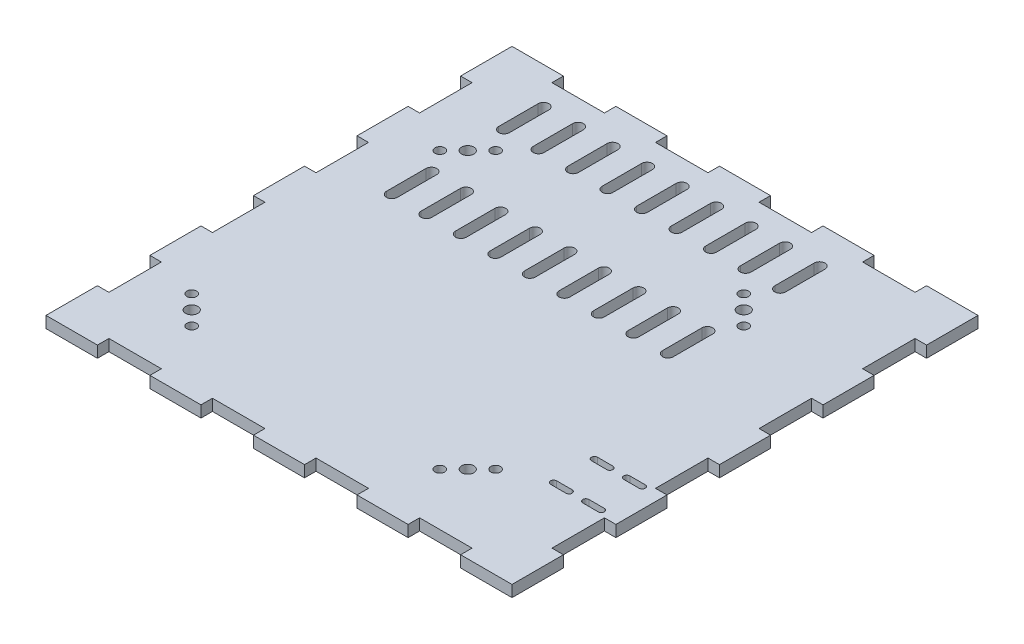
from build123d import *

# Parameters (mm, degrees)
SKETCH2_W           = 130
SKETCH2_H           = 130
SKETCH2_R           = 1.7
BOSS_EXTRUDE1_DEPTH = 3.2
CUT_EXTRUDE2_REACH  = 102.725
SKETCH5_R           = 1.35
SKETCH4_W           = 3.2
SKETCH4_H           = 14.444444445
SKETCH4_W_2         = 14.444444445
SKETCH4_H_2         = 3.2
CUT_EXTRUDE1_DEPTH  = 101.724934847
CUT_EXTRUDE3_REACH  = 102.725
CUT_EXTRUDE4_REACH  = 102.725
TOLERANCE_BY        = 0.1
TOLERANCE_2_BY      = 0.1
TOLERANCE_3_BY      = 0.1
TOLERANCE_4_BY      = 0.1
TOLERANCE_5_BY      = 0.1
TOLERANCE_6_BY      = 0.1
TOLERANCE_7_BY      = 0.1
TOLERANCE_8_BY      = 0.1
TOLERANCE_9_BY      = 0.1
TOLERANCE_10_BY     = 0.1
TOLERANCE_11_BY     = 0.1
TOLERANCE_12_BY     = 0.1
TOLERANCE_13_BY     = 0.1
TOLERANCE_14_BY     = 0.1
TOLERANCE_15_BY     = 0.1
TOLERANCE_16_BY     = 0.1
TOLERANCE_17_BY     = 0.1
TOLERANCE_18_BY     = 0.1
TOLERANCE_19_BY     = 0.1
TOLERANCE_20_BY     = 0.1
TOLERANCE_21_BY     = 0.1
TOLERANCE_22_BY     = 0.1
TOLERANCE_23_BY     = 0.1
TOLERANCE_24_BY     = 0.1
TOLERANCE_25_BY     = 0.1
TOLERANCE_26_BY     = 0.1
TOLERANCE_27_BY     = 0.1
TOLERANCE_28_BY     = 0.1
TOLERANCE_29_BY     = 0.1
TOLERANCE_30_BY     = 0.1
TOLERANCE_31_BY     = 0.1
TOLERANCE_32_BY     = 0.1


with BuildPart() as part:
    # Sketch2 → Boss-Extrude1 (new body)
    with BuildSketch(Plane(origin=(0, 0, 0), x_dir=(1, 0, 0), z_dir=(0, 1, 0))):
        with Locations((7.5, 4.85)):
            Rectangle(SKETCH2_W, SKETCH2_H)
        with Locations((-38.5, 38.5)):
            Circle(SKETCH2_R, mode=Mode.SUBTRACT)
        with Locations((-38.5, -38.5)):
            Circle(SKETCH2_R, mode=Mode.SUBTRACT)
        with Locations((38.5, -38.5)):
            Circle(SKETCH2_R, mode=Mode.SUBTRACT)
        with Locations((38.5, 38.5)):
            Circle(SKETCH2_R, mode=Mode.SUBTRACT)
    extrude(amount=BOSS_EXTRUDE1_DEPTH)

    # Sketch5 → Cut-Extrude2 (cut, up to next)
    with BuildSketch(Plane(origin=(0, 3.2, 0), x_dir=(1, 0, 0), z_dir=(0, 1, 0)), mode=Mode.PRIVATE) as cut_extrude2_sk1:
        with Locations((42.389087297, 34.610912703)):
            Circle(SKETCH5_R)
    cut_extrude2_tool1 = extrude(cut_extrude2_sk1.sketch, amount=-CUT_EXTRUDE2_REACH, mode=Mode.PRIVATE) & part.part
    # Sketch5 → Cut-Extrude2 (cut, up to next)
    with BuildSketch(Plane(origin=(0, 3.2, 0), x_dir=(1, 0, 0), z_dir=(0, 1, 0)), mode=Mode.PRIVATE) as cut_extrude2_sk2:
        with Locations((34.610912703, 42.389087297)):
            Circle(SKETCH5_R)
    cut_extrude2_tool2 = extrude(cut_extrude2_sk2.sketch, amount=-CUT_EXTRUDE2_REACH, mode=Mode.PRIVATE) & part.part
    # Sketch5 → Cut-Extrude2 (cut, up to next)
    with BuildSketch(Plane(origin=(0, 3.2, 0), x_dir=(1, 0, 0), z_dir=(0, 1, 0)), mode=Mode.PRIVATE) as cut_extrude2_sk3:
        with Locations((34.610912703, -42.389087297)):
            Circle(SKETCH5_R)
    cut_extrude2_tool3 = extrude(cut_extrude2_sk3.sketch, amount=-CUT_EXTRUDE2_REACH, mode=Mode.PRIVATE) & part.part
    # Sketch5 → Cut-Extrude2 (cut, up to next)
    with BuildSketch(Plane(origin=(0, 3.2, 0), x_dir=(1, 0, 0), z_dir=(0, 1, 0)), mode=Mode.PRIVATE) as cut_extrude2_sk4:
        with Locations((42.389087297, -34.610912703)):
            Circle(SKETCH5_R)
    cut_extrude2_tool4 = extrude(cut_extrude2_sk4.sketch, amount=-CUT_EXTRUDE2_REACH, mode=Mode.PRIVATE) & part.part
    # Sketch5 → Cut-Extrude2 (cut, up to next)
    with BuildSketch(Plane(origin=(0, 3.2, 0), x_dir=(1, 0, 0), z_dir=(0, 1, 0)), mode=Mode.PRIVATE) as cut_extrude2_sk5:
        with Locations((-42.389087297, -34.610912703)):
            Circle(SKETCH5_R)
    cut_extrude2_tool5 = extrude(cut_extrude2_sk5.sketch, amount=-CUT_EXTRUDE2_REACH, mode=Mode.PRIVATE) & part.part
    # Sketch5 → Cut-Extrude2 (cut, up to next)
    with BuildSketch(Plane(origin=(0, 3.2, 0), x_dir=(1, 0, 0), z_dir=(0, 1, 0)), mode=Mode.PRIVATE) as cut_extrude2_sk6:
        with Locations((-34.610912703, -42.389087297)):
            Circle(SKETCH5_R)
    cut_extrude2_tool6 = extrude(cut_extrude2_sk6.sketch, amount=-CUT_EXTRUDE2_REACH, mode=Mode.PRIVATE) & part.part
    # Sketch5 → Cut-Extrude2 (cut, up to next)
    with BuildSketch(Plane(origin=(0, 3.2, 0), x_dir=(1, 0, 0), z_dir=(0, 1, 0)), mode=Mode.PRIVATE) as cut_extrude2_sk7:
        with Locations((-34.610912703, 42.389087297)):
            Circle(SKETCH5_R)
    cut_extrude2_tool7 = extrude(cut_extrude2_sk7.sketch, amount=-CUT_EXTRUDE2_REACH, mode=Mode.PRIVATE) & part.part
    # Sketch5 → Cut-Extrude2 (cut, up to next)
    with BuildSketch(Plane(origin=(0, 3.2, 0), x_dir=(1, 0, 0), z_dir=(0, 1, 0)), mode=Mode.PRIVATE) as cut_extrude2_sk8:
        with Locations((-42.389087297, 34.610912703)):
            Circle(SKETCH5_R)
    cut_extrude2_tool8 = extrude(cut_extrude2_sk8.sketch, amount=-CUT_EXTRUDE2_REACH, mode=Mode.PRIVATE) & part.part
    add(cut_extrude2_tool1.solids().sort_by_distance((42.389087, 3.2, -34.610913))[0], mode=Mode.SUBTRACT)
    add(cut_extrude2_tool2.solids().sort_by_distance((34.610913, 3.2, -42.389087))[0], mode=Mode.SUBTRACT)
    add(cut_extrude2_tool3.solids().sort_by_distance((34.610913, 3.2, 42.389087))[0], mode=Mode.SUBTRACT)
    add(cut_extrude2_tool4.solids().sort_by_distance((42.389087, 3.2, 34.610913))[0], mode=Mode.SUBTRACT)
    add(cut_extrude2_tool5.solids().sort_by_distance((-42.389087, 3.2, 34.610913))[0], mode=Mode.SUBTRACT)
    add(cut_extrude2_tool6.solids().sort_by_distance((-34.610913, 3.2, 42.389087))[0], mode=Mode.SUBTRACT)
    add(cut_extrude2_tool7.solids().sort_by_distance((-34.610913, 3.2, -42.389087))[0], mode=Mode.SUBTRACT)
    add(cut_extrude2_tool8.solids().sort_by_distance((-42.389087, 3.2, -34.610913))[0], mode=Mode.SUBTRACT)

    # Sketch4 → Cut-Extrude1 (cut, through all)
    with BuildSketch(Plane(origin=(0, 3.2, 0), x_dir=(1, 0, 0), z_dir=(0, 1, 0))):
        with Locations((70.9, 48.183333334)):
            Rectangle(SKETCH4_W, SKETCH4_H)
        with Locations((70.9, 19.294444445)):
            Rectangle(SKETCH4_W, SKETCH4_H)
        with Locations((70.9, -9.594444445)):
            Rectangle(SKETCH4_W, SKETCH4_H)
        with Locations((70.9, -38.483333333)):
            Rectangle(SKETCH4_W, SKETCH4_H)
        with Locations((-35.833333334, -58.55)):
            Rectangle(SKETCH4_W_2, SKETCH4_H_2)
        with Locations((-6.944444445, -58.55)):
            Rectangle(SKETCH4_W_2, SKETCH4_H_2)
        with Locations((21.944444445, -58.55)):
            Rectangle(SKETCH4_W_2, SKETCH4_H_2)
        with Locations((50.833333334, -58.55)):
            Rectangle(SKETCH4_W_2, SKETCH4_H_2)
        with Locations((-55.9, 48.183333334)):
            Rectangle(SKETCH4_W, SKETCH4_H)
        with Locations((-55.9, 19.294444445)):
            Rectangle(SKETCH4_W, SKETCH4_H)
        with Locations((-55.9, -9.594444445)):
            Rectangle(SKETCH4_W, SKETCH4_H)
        with Locations((-55.9, -38.483333333)):
            Rectangle(SKETCH4_W, SKETCH4_H)
        with Locations((50.833333334, 68.25)):
            Rectangle(SKETCH4_W_2, SKETCH4_H_2)
        with Locations((21.944444445, 68.25)):
            Rectangle(SKETCH4_W_2, SKETCH4_H_2)
        with Locations((-6.944444445, 68.25)):
            Rectangle(SKETCH4_W_2, SKETCH4_H_2)
        with Locations((-35.833333334, 68.25)):
            Rectangle(SKETCH4_W_2, SKETCH4_H_2)
    extrude(amount=-CUT_EXTRUDE1_DEPTH, mode=Mode.SUBTRACT)

    # Sketch6 → Cut-Extrude3 (cut, up to next)
    with BuildSketch(Plane(origin=(0, 3.2, 0), x_dir=(1, 0, 0), z_dir=(0, 1, 0)), mode=Mode.PRIVATE) as cut_extrude3_sk1:
        with BuildLine():
            Line((67, -30.588888889), (62.7, -30.588888889))
            ThreePointArc((62.7, -30.588888889), (61.85, -29.738888889), (62.7, -28.888888889))
            Line((62.7, -28.888888889), (67, -28.888888889))
            ThreePointArc((67, -28.888888889), (67.85, -29.738888889), (67, -30.588888889))
        make_face()
    cut_extrude3_tool1 = extrude(cut_extrude3_sk1.sketch, amount=-CUT_EXTRUDE3_REACH, mode=Mode.PRIVATE) & part.part
    # Sketch6 → Cut-Extrude3 (cut, up to next)
    with BuildSketch(Plane(origin=(0, 3.2, 0), x_dir=(1, 0, 0), z_dir=(0, 1, 0)), mode=Mode.PRIVATE) as cut_extrude3_sk2:
        with BuildLine():
            Line((58, -30.588888889), (53.7, -30.588888889))
            ThreePointArc((53.7, -30.588888889), (52.85, -29.738888889), (53.7, -28.888888889))
            Line((53.7, -28.888888889), (58, -28.888888889))
            ThreePointArc((58, -28.888888889), (58.85, -29.738888889), (58, -30.588888889))
        make_face()
    cut_extrude3_tool2 = extrude(cut_extrude3_sk2.sketch, amount=-CUT_EXTRUDE3_REACH, mode=Mode.PRIVATE) & part.part
    # Sketch6 → Cut-Extrude3 (cut, up to next)
    with BuildSketch(Plane(origin=(0, 3.2, 0), x_dir=(1, 0, 0), z_dir=(0, 1, 0)), mode=Mode.PRIVATE) as cut_extrude3_sk3:
        with BuildLine():
            Line((58, -17.488888889), (53.7, -17.488888889))
            ThreePointArc((53.7, -17.488888889), (52.85, -18.338888889), (53.7, -19.188888889))
            Line((53.7, -19.188888889), (58, -19.188888889))
            ThreePointArc((58, -19.188888889), (58.85, -18.338888889), (58, -17.488888889))
        make_face()
    cut_extrude3_tool3 = extrude(cut_extrude3_sk3.sketch, amount=-CUT_EXTRUDE3_REACH, mode=Mode.PRIVATE) & part.part
    # Sketch6 → Cut-Extrude3 (cut, up to next)
    with BuildSketch(Plane(origin=(0, 3.2, 0), x_dir=(1, 0, 0), z_dir=(0, 1, 0)), mode=Mode.PRIVATE) as cut_extrude3_sk4:
        with BuildLine():
            Line((67, -17.488888889), (62.7, -17.488888889))
            ThreePointArc((62.7, -17.488888889), (61.85, -18.338888889), (62.7, -19.188888889))
            Line((62.7, -19.188888889), (67, -19.188888889))
            ThreePointArc((67, -19.188888889), (67.85, -18.338888889), (67, -17.488888889))
        make_face()
    cut_extrude3_tool4 = extrude(cut_extrude3_sk4.sketch, amount=-CUT_EXTRUDE3_REACH, mode=Mode.PRIVATE) & part.part
    add(cut_extrude3_tool1.solids().sort_by_distance((64.85, 3.2, 29.738889))[0], mode=Mode.SUBTRACT)
    add(cut_extrude3_tool2.solids().sort_by_distance((55.85, 3.2, 29.738889))[0], mode=Mode.SUBTRACT)
    add(cut_extrude3_tool3.solids().sort_by_distance((55.85, 3.2, 18.338889))[0], mode=Mode.SUBTRACT)
    add(cut_extrude3_tool4.solids().sort_by_distance((64.85, 3.2, 18.338889))[0], mode=Mode.SUBTRACT)

    # Sketch7 → Cut-Extrude4 (cut, up to next)
    with BuildSketch(Plane(origin=(0, 3.2, 0), x_dir=(1, 0, 0), z_dir=(0, 1, 0)), mode=Mode.PRIVATE) as cut_extrude4_sk1:
        with BuildLine():
            Line((-37, 59.65), (-37, 48.65))
            ThreePointArc((-37, 48.65), (-38.5, 47.15), (-40, 48.65))
            Line((-40, 48.65), (-40, 59.65))
            ThreePointArc((-40, 59.65), (-38.5, 61.15), (-37, 59.65))
        make_face()
    cut_extrude4_tool1 = extrude(cut_extrude4_sk1.sketch, amount=-CUT_EXTRUDE4_REACH, mode=Mode.PRIVATE) & part.part
    # Sketch7 → Cut-Extrude4 (cut, up to next)
    with BuildSketch(Plane(origin=(0, 3.2, 0), x_dir=(1, 0, 0), z_dir=(0, 1, 0)), mode=Mode.PRIVATE) as cut_extrude4_sk2:
        with BuildLine():
            Line((-30.375, 59.65), (-30.375, 48.65))
            ThreePointArc((-30.375, 48.65), (-28.875, 47.15), (-27.375, 48.65))
            Line((-27.375, 48.65), (-27.375, 59.65))
            ThreePointArc((-27.375, 59.65), (-28.875, 61.15), (-30.375, 59.65))
        make_face()
    cut_extrude4_tool2 = extrude(cut_extrude4_sk2.sketch, amount=-CUT_EXTRUDE4_REACH, mode=Mode.PRIVATE) & part.part
    # Sketch7 → Cut-Extrude4 (cut, up to next)
    with BuildSketch(Plane(origin=(0, 3.2, 0), x_dir=(1, 0, 0), z_dir=(0, 1, 0)), mode=Mode.PRIVATE) as cut_extrude4_sk3:
        with BuildLine():
            Line((-20.75, 59.65), (-20.75, 48.65))
            ThreePointArc((-20.75, 48.65), (-19.25, 47.15), (-17.75, 48.65))
            Line((-17.75, 48.65), (-17.75, 59.65))
            ThreePointArc((-17.75, 59.65), (-19.25, 61.15), (-20.75, 59.65))
        make_face()
    cut_extrude4_tool3 = extrude(cut_extrude4_sk3.sketch, amount=-CUT_EXTRUDE4_REACH, mode=Mode.PRIVATE) & part.part
    # Sketch7 → Cut-Extrude4 (cut, up to next)
    with BuildSketch(Plane(origin=(0, 3.2, 0), x_dir=(1, 0, 0), z_dir=(0, 1, 0)), mode=Mode.PRIVATE) as cut_extrude4_sk4:
        with BuildLine():
            Line((-11.125, 59.65), (-11.125, 48.65))
            ThreePointArc((-11.125, 48.65), (-9.625, 47.15), (-8.125, 48.65))
            Line((-8.125, 48.65), (-8.125, 59.65))
            ThreePointArc((-8.125, 59.65), (-9.625, 61.15), (-11.125, 59.65))
        make_face()
    cut_extrude4_tool4 = extrude(cut_extrude4_sk4.sketch, amount=-CUT_EXTRUDE4_REACH, mode=Mode.PRIVATE) & part.part
    # Sketch7 → Cut-Extrude4 (cut, up to next)
    with BuildSketch(Plane(origin=(0, 3.2, 0), x_dir=(1, 0, 0), z_dir=(0, 1, 0)), mode=Mode.PRIVATE) as cut_extrude4_sk5:
        with BuildLine():
            Line((-1.5, 59.65), (-1.5, 48.65))
            ThreePointArc((-1.5, 48.65), (0, 47.15), (1.5, 48.65))
            Line((1.5, 48.65), (1.5, 59.65))
            ThreePointArc((1.5, 59.65), (0, 61.15), (-1.5, 59.65))
        make_face()
    cut_extrude4_tool5 = extrude(cut_extrude4_sk5.sketch, amount=-CUT_EXTRUDE4_REACH, mode=Mode.PRIVATE) & part.part
    # Sketch7 → Cut-Extrude4 (cut, up to next)
    with BuildSketch(Plane(origin=(0, 3.2, 0), x_dir=(1, 0, 0), z_dir=(0, 1, 0)), mode=Mode.PRIVATE) as cut_extrude4_sk6:
        with BuildLine():
            Line((8.125, 59.65), (8.125, 48.65))
            ThreePointArc((8.125, 48.65), (9.625, 47.15), (11.125, 48.65))
            Line((11.125, 48.65), (11.125, 59.65))
            ThreePointArc((11.125, 59.65), (9.625, 61.15), (8.125, 59.65))
        make_face()
    cut_extrude4_tool6 = extrude(cut_extrude4_sk6.sketch, amount=-CUT_EXTRUDE4_REACH, mode=Mode.PRIVATE) & part.part
    # Sketch7 → Cut-Extrude4 (cut, up to next)
    with BuildSketch(Plane(origin=(0, 3.2, 0), x_dir=(1, 0, 0), z_dir=(0, 1, 0)), mode=Mode.PRIVATE) as cut_extrude4_sk7:
        with BuildLine():
            Line((17.75, 59.65), (17.75, 48.65))
            ThreePointArc((17.75, 48.65), (19.25, 47.15), (20.75, 48.65))
            Line((20.75, 48.65), (20.75, 59.65))
            ThreePointArc((20.75, 59.65), (19.25, 61.15), (17.75, 59.65))
        make_face()
    cut_extrude4_tool7 = extrude(cut_extrude4_sk7.sketch, amount=-CUT_EXTRUDE4_REACH, mode=Mode.PRIVATE) & part.part
    # Sketch7 → Cut-Extrude4 (cut, up to next)
    with BuildSketch(Plane(origin=(0, 3.2, 0), x_dir=(1, 0, 0), z_dir=(0, 1, 0)), mode=Mode.PRIVATE) as cut_extrude4_sk8:
        with BuildLine():
            Line((27.375, 59.65), (27.375, 48.65))
            ThreePointArc((27.375, 48.65), (28.875, 47.15), (30.375, 48.65))
            Line((30.375, 48.65), (30.375, 59.65))
            ThreePointArc((30.375, 59.65), (28.875, 61.15), (27.375, 59.65))
        make_face()
    cut_extrude4_tool8 = extrude(cut_extrude4_sk8.sketch, amount=-CUT_EXTRUDE4_REACH, mode=Mode.PRIVATE) & part.part
    # Sketch7 → Cut-Extrude4 (cut, up to next)
    with BuildSketch(Plane(origin=(0, 3.2, 0), x_dir=(1, 0, 0), z_dir=(0, 1, 0)), mode=Mode.PRIVATE) as cut_extrude4_sk9:
        with BuildLine():
            Line((37, 59.65), (37, 48.65))
            ThreePointArc((37, 48.65), (38.5, 47.15), (40, 48.65))
            Line((40, 48.65), (40, 59.65))
            ThreePointArc((40, 59.65), (38.5, 61.15), (37, 59.65))
        make_face()
    cut_extrude4_tool9 = extrude(cut_extrude4_sk9.sketch, amount=-CUT_EXTRUDE4_REACH, mode=Mode.PRIVATE) & part.part
    # Sketch7 → Cut-Extrude4 (cut, up to next)
    with BuildSketch(Plane(origin=(0, 3.2, 0), x_dir=(1, 0, 0), z_dir=(0, 1, 0)), mode=Mode.PRIVATE) as cut_extrude4_sk10:
        with BuildLine():
            Line((-40, 28.35), (-40, 17.35))
            ThreePointArc((-40, 17.35), (-38.5, 15.85), (-37, 17.35))
            Line((-37, 17.35), (-37, 28.35))
            ThreePointArc((-37, 28.35), (-38.5, 29.85), (-40, 28.35))
        make_face()
    cut_extrude4_tool10 = extrude(cut_extrude4_sk10.sketch, amount=-CUT_EXTRUDE4_REACH, mode=Mode.PRIVATE) & part.part
    # Sketch7 → Cut-Extrude4 (cut, up to next)
    with BuildSketch(Plane(origin=(0, 3.2, 0), x_dir=(1, 0, 0), z_dir=(0, 1, 0)), mode=Mode.PRIVATE) as cut_extrude4_sk11:
        with BuildLine():
            Line((-30.375, 28.35), (-30.375, 17.35))
            ThreePointArc((-30.375, 17.35), (-28.875, 15.85), (-27.375, 17.35))
            Line((-27.375, 17.35), (-27.375, 28.35))
            ThreePointArc((-27.375, 28.35), (-28.875, 29.85), (-30.375, 28.35))
        make_face()
    cut_extrude4_tool11 = extrude(cut_extrude4_sk11.sketch, amount=-CUT_EXTRUDE4_REACH, mode=Mode.PRIVATE) & part.part
    # Sketch7 → Cut-Extrude4 (cut, up to next)
    with BuildSketch(Plane(origin=(0, 3.2, 0), x_dir=(1, 0, 0), z_dir=(0, 1, 0)), mode=Mode.PRIVATE) as cut_extrude4_sk12:
        with BuildLine():
            Line((-20.75, 28.35), (-20.75, 17.35))
            ThreePointArc((-20.75, 17.35), (-19.25, 15.85), (-17.75, 17.35))
            Line((-17.75, 17.35), (-17.75, 28.35))
            ThreePointArc((-17.75, 28.35), (-19.25, 29.85), (-20.75, 28.35))
        make_face()
    cut_extrude4_tool12 = extrude(cut_extrude4_sk12.sketch, amount=-CUT_EXTRUDE4_REACH, mode=Mode.PRIVATE) & part.part
    # Sketch7 → Cut-Extrude4 (cut, up to next)
    with BuildSketch(Plane(origin=(0, 3.2, 0), x_dir=(1, 0, 0), z_dir=(0, 1, 0)), mode=Mode.PRIVATE) as cut_extrude4_sk13:
        with BuildLine():
            Line((-11.125, 28.35), (-11.125, 17.35))
            ThreePointArc((-11.125, 17.35), (-9.625, 15.85), (-8.125, 17.35))
            Line((-8.125, 17.35), (-8.125, 28.35))
            ThreePointArc((-8.125, 28.35), (-9.625, 29.85), (-11.125, 28.35))
        make_face()
    cut_extrude4_tool13 = extrude(cut_extrude4_sk13.sketch, amount=-CUT_EXTRUDE4_REACH, mode=Mode.PRIVATE) & part.part
    # Sketch7 → Cut-Extrude4 (cut, up to next)
    with BuildSketch(Plane(origin=(0, 3.2, 0), x_dir=(1, 0, 0), z_dir=(0, 1, 0)), mode=Mode.PRIVATE) as cut_extrude4_sk14:
        with BuildLine():
            Line((-1.5, 28.35), (-1.5, 17.35))
            ThreePointArc((-1.5, 17.35), (0, 15.85), (1.5, 17.35))
            Line((1.5, 17.35), (1.5, 28.35))
            ThreePointArc((1.5, 28.35), (0, 29.85), (-1.5, 28.35))
        make_face()
    cut_extrude4_tool14 = extrude(cut_extrude4_sk14.sketch, amount=-CUT_EXTRUDE4_REACH, mode=Mode.PRIVATE) & part.part
    # Sketch7 → Cut-Extrude4 (cut, up to next)
    with BuildSketch(Plane(origin=(0, 3.2, 0), x_dir=(1, 0, 0), z_dir=(0, 1, 0)), mode=Mode.PRIVATE) as cut_extrude4_sk15:
        with BuildLine():
            Line((8.125, 28.35), (8.125, 17.35))
            ThreePointArc((8.125, 17.35), (9.625, 15.85), (11.125, 17.35))
            Line((11.125, 17.35), (11.125, 28.35))
            ThreePointArc((11.125, 28.35), (9.625, 29.85), (8.125, 28.35))
        make_face()
    cut_extrude4_tool15 = extrude(cut_extrude4_sk15.sketch, amount=-CUT_EXTRUDE4_REACH, mode=Mode.PRIVATE) & part.part
    # Sketch7 → Cut-Extrude4 (cut, up to next)
    with BuildSketch(Plane(origin=(0, 3.2, 0), x_dir=(1, 0, 0), z_dir=(0, 1, 0)), mode=Mode.PRIVATE) as cut_extrude4_sk16:
        with BuildLine():
            Line((17.75, 28.35), (17.75, 17.35))
            ThreePointArc((17.75, 17.35), (19.25, 15.85), (20.75, 17.35))
            Line((20.75, 17.35), (20.75, 28.35))
            ThreePointArc((20.75, 28.35), (19.25, 29.85), (17.75, 28.35))
        make_face()
    cut_extrude4_tool16 = extrude(cut_extrude4_sk16.sketch, amount=-CUT_EXTRUDE4_REACH, mode=Mode.PRIVATE) & part.part
    # Sketch7 → Cut-Extrude4 (cut, up to next)
    with BuildSketch(Plane(origin=(0, 3.2, 0), x_dir=(1, 0, 0), z_dir=(0, 1, 0)), mode=Mode.PRIVATE) as cut_extrude4_sk17:
        with BuildLine():
            Line((27.375, 28.35), (27.375, 17.35))
            ThreePointArc((27.375, 17.35), (28.875, 15.85), (30.375, 17.35))
            Line((30.375, 17.35), (30.375, 28.35))
            ThreePointArc((30.375, 28.35), (28.875, 29.85), (27.375, 28.35))
        make_face()
    cut_extrude4_tool17 = extrude(cut_extrude4_sk17.sketch, amount=-CUT_EXTRUDE4_REACH, mode=Mode.PRIVATE) & part.part
    # Sketch7 → Cut-Extrude4 (cut, up to next)
    with BuildSketch(Plane(origin=(0, 3.2, 0), x_dir=(1, 0, 0), z_dir=(0, 1, 0)), mode=Mode.PRIVATE) as cut_extrude4_sk18:
        with BuildLine():
            Line((37, 28.35), (37, 17.35))
            ThreePointArc((37, 17.35), (38.5, 15.85), (40, 17.35))
            Line((40, 17.35), (40, 28.35))
            ThreePointArc((40, 28.35), (38.5, 29.85), (37, 28.35))
        make_face()
    cut_extrude4_tool18 = extrude(cut_extrude4_sk18.sketch, amount=-CUT_EXTRUDE4_REACH, mode=Mode.PRIVATE) & part.part
    add(cut_extrude4_tool1.solids().sort_by_distance((-38.5, 3.2, -54.15))[0], mode=Mode.SUBTRACT)
    add(cut_extrude4_tool2.solids().sort_by_distance((-28.875, 3.2, -54.15))[0], mode=Mode.SUBTRACT)
    add(cut_extrude4_tool3.solids().sort_by_distance((-19.25, 3.2, -54.15))[0], mode=Mode.SUBTRACT)
    add(cut_extrude4_tool4.solids().sort_by_distance((-9.625, 3.2, -54.15))[0], mode=Mode.SUBTRACT)
    add(cut_extrude4_tool5.solids().sort_by_distance((0, 3.2, -54.15))[0], mode=Mode.SUBTRACT)
    add(cut_extrude4_tool6.solids().sort_by_distance((9.625, 3.2, -54.15))[0], mode=Mode.SUBTRACT)
    add(cut_extrude4_tool7.solids().sort_by_distance((19.25, 3.2, -54.15))[0], mode=Mode.SUBTRACT)
    add(cut_extrude4_tool8.solids().sort_by_distance((28.875, 3.2, -54.15))[0], mode=Mode.SUBTRACT)
    add(cut_extrude4_tool9.solids().sort_by_distance((38.5, 3.2, -54.15))[0], mode=Mode.SUBTRACT)
    add(cut_extrude4_tool10.solids().sort_by_distance((-38.5, 3.2, -22.85))[0], mode=Mode.SUBTRACT)
    add(cut_extrude4_tool11.solids().sort_by_distance((-28.875, 3.2, -22.85))[0], mode=Mode.SUBTRACT)
    add(cut_extrude4_tool12.solids().sort_by_distance((-19.25, 3.2, -22.85))[0], mode=Mode.SUBTRACT)
    add(cut_extrude4_tool13.solids().sort_by_distance((-9.625, 3.2, -22.85))[0], mode=Mode.SUBTRACT)
    add(cut_extrude4_tool14.solids().sort_by_distance((0, 3.2, -22.85))[0], mode=Mode.SUBTRACT)
    add(cut_extrude4_tool15.solids().sort_by_distance((9.625, 3.2, -22.85))[0], mode=Mode.SUBTRACT)
    add(cut_extrude4_tool16.solids().sort_by_distance((19.25, 3.2, -22.85))[0], mode=Mode.SUBTRACT)
    add(cut_extrude4_tool17.solids().sort_by_distance((28.875, 3.2, -22.85))[0], mode=Mode.SUBTRACT)
    add(cut_extrude4_tool18.solids().sort_by_distance((38.5, 3.2, -22.85))[0], mode=Mode.SUBTRACT)

    # Tolerance: a face moved inward by 0.1
    extrude(part.faces().sort_by_distance((43.611111111, 1.6, -68.25))[0], amount=TOLERANCE_BY, dir=(-1, 0, 0), mode=Mode.SUBTRACT)

    # Tolerance 2: a face moved inward by 0.1
    extrude(part.faces().sort_by_distance((14.722222222, 1.6, -68.25))[0], amount=TOLERANCE_2_BY, dir=(-1, 0, 0), mode=Mode.SUBTRACT)

    # Tolerance 3: a face moved inward by 0.1
    extrude(part.faces().sort_by_distance((-14.166666667, 1.6, -68.25))[0], amount=TOLERANCE_3_BY, dir=(-1, 0, 0), mode=Mode.SUBTRACT)

    # Tolerance 4: a face moved inward by 0.1
    extrude(part.faces().sort_by_distance((-43.055555556, 1.6, -68.25))[0], amount=TOLERANCE_4_BY, dir=(-1, 0, 0), mode=Mode.SUBTRACT)

    # Tolerance 5: a face moved inward by 0.1
    extrude(part.faces().sort_by_distance((29.166666667, 1.6, -68.25))[0], amount=TOLERANCE_5_BY, dir=(1, 0, 0), mode=Mode.SUBTRACT)

    # Tolerance 6: a face moved inward by 0.1
    extrude(part.faces().sort_by_distance((58.055555556, 1.6, -68.25))[0], amount=TOLERANCE_6_BY, dir=(1, 0, 0), mode=Mode.SUBTRACT)

    # Tolerance 7: a face moved inward by 0.1
    extrude(part.faces().sort_by_distance((0.277777778, 1.6, -68.25))[0], amount=TOLERANCE_7_BY, dir=(1, 0, 0), mode=Mode.SUBTRACT)

    # Tolerance 8: a face moved inward by 0.1
    extrude(part.faces().sort_by_distance((-28.611111111, 1.6, -68.25))[0], amount=TOLERANCE_8_BY, dir=(1, 0, 0), mode=Mode.SUBTRACT)

    # Tolerance 9: a face moved inward by 0.1
    extrude(part.faces().sort_by_distance((-55.9, 1.6, -40.961111111))[0], amount=TOLERANCE_9_BY, dir=(0, 0, 1), mode=Mode.SUBTRACT)

    # Tolerance 10: a face moved inward by 0.1
    extrude(part.faces().sort_by_distance((-55.9, 1.6, -55.405555556))[0], amount=TOLERANCE_10_BY, dir=(0, 0, -1), mode=Mode.SUBTRACT)

    # Tolerance 11: a face moved inward by 0.1
    extrude(part.faces().sort_by_distance((-55.9, 1.6, -12.072222222))[0], amount=TOLERANCE_11_BY, dir=(0, 0, 1), mode=Mode.SUBTRACT)

    # Tolerance 12: a face moved inward by 0.1
    extrude(part.faces().sort_by_distance((-55.9, 1.6, -26.516666667))[0], amount=TOLERANCE_12_BY, dir=(0, 0, -1), mode=Mode.SUBTRACT)

    # Tolerance 13: a face moved inward by 0.1
    extrude(part.faces().sort_by_distance((-55.9, 1.6, 2.372222222))[0], amount=TOLERANCE_13_BY, dir=(0, 0, -1), mode=Mode.SUBTRACT)

    # Tolerance 14: a face moved inward by 0.1
    extrude(part.faces().sort_by_distance((-55.9, 1.6, 16.816666667))[0], amount=TOLERANCE_14_BY, dir=(0, 0, 1), mode=Mode.SUBTRACT)

    # Tolerance 15: a face moved inward by 0.1
    extrude(part.faces().sort_by_distance((-55.9, 1.6, 45.705555556))[0], amount=TOLERANCE_15_BY, dir=(0, 0, 1), mode=Mode.SUBTRACT)

    # Tolerance 16: a face moved inward by 0.1
    extrude(part.faces().sort_by_distance((-55.9, 1.6, 31.261111111))[0], amount=TOLERANCE_16_BY, dir=(0, 0, -1), mode=Mode.SUBTRACT)

    # Tolerance 17: a face moved inward by 0.1
    extrude(part.faces().sort_by_distance((-28.611111111, 1.6, 58.55))[0], amount=TOLERANCE_17_BY, dir=(1, 0, 0), mode=Mode.SUBTRACT)

    # Tolerance 18: a face moved inward by 0.1
    extrude(part.faces().sort_by_distance((-43.055555556, 1.6, 58.55))[0], amount=TOLERANCE_18_BY, dir=(-1, 0, 0), mode=Mode.SUBTRACT)

    # Tolerance 19: a face moved inward by 0.1
    extrude(part.faces().sort_by_distance((-14.166666667, 1.6, 58.55))[0], amount=TOLERANCE_19_BY, dir=(-1, 0, 0), mode=Mode.SUBTRACT)

    # Tolerance 20: a face moved inward by 0.1
    extrude(part.faces().sort_by_distance((0.277777778, 1.6, 58.55))[0], amount=TOLERANCE_20_BY, dir=(1, 0, 0), mode=Mode.SUBTRACT)

    # Tolerance 21: a face moved inward by 0.1
    extrude(part.faces().sort_by_distance((14.722222222, 1.6, 58.55))[0], amount=TOLERANCE_21_BY, dir=(-1, 0, 0), mode=Mode.SUBTRACT)

    # Tolerance 22: a face moved inward by 0.1
    extrude(part.faces().sort_by_distance((29.166666667, 1.6, 58.55))[0], amount=TOLERANCE_22_BY, dir=(1, 0, 0), mode=Mode.SUBTRACT)

    # Tolerance 23: a face moved inward by 0.1
    extrude(part.faces().sort_by_distance((58.055555556, 1.6, 58.55))[0], amount=TOLERANCE_23_BY, dir=(1, 0, 0), mode=Mode.SUBTRACT)

    # Tolerance 24: a face moved inward by 0.1
    extrude(part.faces().sort_by_distance((43.611111111, 1.6, 58.55))[0], amount=TOLERANCE_24_BY, dir=(-1, 0, 0), mode=Mode.SUBTRACT)

    # Tolerance 25: a face moved inward by 0.1
    extrude(part.faces().sort_by_distance((70.9, 1.6, 31.261111111))[0], amount=TOLERANCE_25_BY, dir=(0, 0, -1), mode=Mode.SUBTRACT)

    # Tolerance 26: a face moved inward by 0.1
    extrude(part.faces().sort_by_distance((70.9, 1.6, 45.705555556))[0], amount=TOLERANCE_26_BY, dir=(0, 0, 1), mode=Mode.SUBTRACT)

    # Tolerance 27: a face moved inward by 0.1
    extrude(part.faces().sort_by_distance((70.9, 1.6, 16.816666667))[0], amount=TOLERANCE_27_BY, dir=(0, 0, 1), mode=Mode.SUBTRACT)

    # Tolerance 28: a face moved inward by 0.1
    extrude(part.faces().sort_by_distance((70.9, 1.6, 2.372222222))[0], amount=TOLERANCE_28_BY, dir=(0, 0, -1), mode=Mode.SUBTRACT)

    # Tolerance 29: a face moved inward by 0.1
    extrude(part.faces().sort_by_distance((70.9, 1.6, -12.072222222))[0], amount=TOLERANCE_29_BY, dir=(0, 0, 1), mode=Mode.SUBTRACT)

    # Tolerance 30: a face moved inward by 0.1
    extrude(part.faces().sort_by_distance((70.9, 1.6, -26.516666667))[0], amount=TOLERANCE_30_BY, dir=(0, 0, -1), mode=Mode.SUBTRACT)

    # Tolerance 31: a face moved inward by 0.1
    extrude(part.faces().sort_by_distance((70.9, 1.6, -55.405555556))[0], amount=TOLERANCE_31_BY, dir=(0, 0, -1), mode=Mode.SUBTRACT)

    # Tolerance 32: a face moved inward by 0.1
    extrude(part.faces().sort_by_distance((70.9, 1.6, -40.961111111))[0], amount=TOLERANCE_32_BY, dir=(0, 0, 1), mode=Mode.SUBTRACT)


solid = part.part
